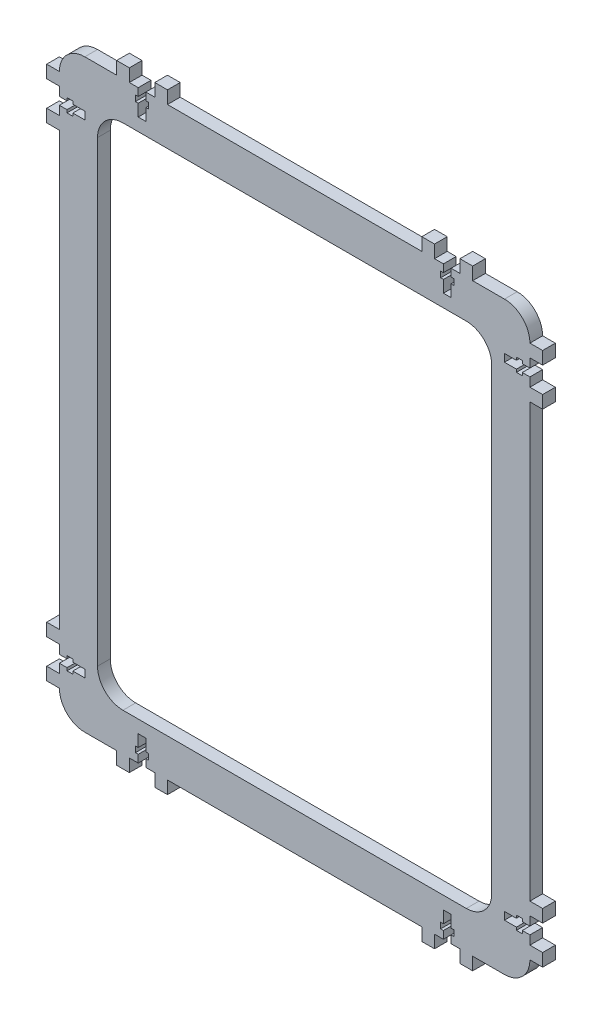
from build123d import *

# Parameters (mm, degrees)
SKETCH1_W           = 155
SKETCH1_H           = 200
BOSS_EXTRUDE1_DEPTH = 5
FILLET1_DEPTH       = 5
FILLET1_2_DEPTH     = 5


with BuildPart() as part:
    # Sketch1 → Boss-Extrude1 (new body)
    with BuildSketch(Plane.XY):
        Polygon((-92.5, 96.5), (-92.5, 100), (-97.5, 100), (-97.5, 105), (-92.5, 105), (-92.5, 115), (-70, 115), (-70, 120), (-65, 120), (-65, 115), (-61.5, 115), (-61.5, 112), (-62.6, 112), (-62.6, 109.7), (-61.5, 109.7), (-61.5, 105), (-58.5, 105), (-58.5, 109.7), (-57.4, 109.7), (-57.4, 112), (-58.5, 112), (-58.5, 115), (-55, 115), (-55, 120), (-50, 120), (-50, 115), (50, 115), (50, 120), (55, 120), (55, 115), (58.5, 115), (58.5, 112), (57.4, 112), (57.4, 109.7), (58.5, 109.7), (58.5, 105), (61.5, 105), (61.5, 109.7), (62.6, 109.7), (62.6, 112), (61.5, 112), (61.5, 115), (65, 115), (65, 120), (70, 120), (70, 115), (92.5, 115), (92.5, 105), (97.5, 105), (97.5, 100), (92.5, 100), (92.5, 96.5), (89.5, 96.5), (89.5, 97.6), (87.2, 97.6), (87.2, 96.5), (82.5, 96.5), (82.5, 93.5), (87.2, 93.5), (87.2, 92.4), (89.5, 92.4), (89.5, 93.5), (92.5, 93.5), (92.5, 90), (97.5, 90), (97.5, 85), (92.5, 85), (92.5, -85), (97.5, -85), (97.5, -90), (92.5, -90), (92.5, -93.5), (89.5, -93.5), (89.5, -92.4), (87.2, -92.4), (87.2, -93.5), (82.5, -93.5), (82.5, -96.5), (87.2, -96.5), (87.2, -97.6), (89.5, -97.6), (89.5, -96.5), (92.5, -96.5), (92.5, -100), (97.5, -100), (97.5, -105), (92.5, -105), (92.5, -115), (70, -115), (70, -120), (65, -120), (65, -115), (61.5, -115), (61.5, -112), (62.6, -112), (62.6, -109.7), (61.5, -109.7), (61.5, -105), (58.5, -105), (58.5, -109.7), (57.4, -109.7), (57.4, -112), (58.5, -112), (58.5, -115), (55, -115), (55, -120), (50, -120), (50, -115), (-50, -115), (-50, -120), (-55, -120), (-55, -115), (-58.5, -115), (-58.5, -112), (-57.4, -112), (-57.4, -109.7), (-58.5, -109.7), (-58.5, -105), (-61.5, -105), (-61.5, -109.7), (-62.6, -109.7), (-62.6, -112), (-61.5, -112), (-61.5, -115), (-65, -115), (-65, -120), (-70, -120), (-70, -115), (-92.5, -115), (-92.5, -105), (-97.5, -105), (-97.5, -100), (-92.5, -100), (-92.5, -96.5), (-89.5, -96.5), (-89.5, -97.6), (-87.2, -97.6), (-87.2, -96.5), (-82.5, -96.5), (-82.5, -93.5), (-87.2, -93.5), (-87.2, -92.4), (-89.5, -92.4), (-89.5, -93.5), (-92.5, -93.5), (-92.5, -90), (-97.5, -90), (-97.5, -85), (-92.5, -85), (-92.5, 85), (-97.5, 85), (-97.5, 90), (-92.5, 90), (-92.5, 93.5), (-89.5, 93.5), (-89.5, 92.4), (-87.2, 92.4), (-87.2, 93.5), (-82.5, 93.5), (-82.5, 96.5), (-87.2, 96.5), (-87.2, 97.6), (-89.5, 97.6), (-89.5, 96.5), align=None)
        Rectangle(SKETCH1_W, SKETCH1_H, mode=Mode.SUBTRACT)
    extrude(amount=BOSS_EXTRUDE1_DEPTH)

    # Fillet1: read off the stored shape, not the designer's step
    # Fillet1 outline → Fillet1 (cut)
    with BuildSketch(Plane.XY):
        with BuildLine():
            Line((92.5, -115), (92.5, -105))
            ThreePointArc((92.5, -105), (89.571067812, -112.071067812), (82.5, -115))
            Line((82.5, -115), (92.5, -115))
        make_face()
        with BuildLine():
            Line((-92.5, -115), (-82.5, -115))
            ThreePointArc((-82.5, -115), (-89.571067812, -112.071067812), (-92.5, -105))
            Line((-92.5, -105), (-92.5, -115))
        make_face()
        with BuildLine():
            Line((-92.5, 115), (-92.5, 105))
            ThreePointArc((-92.5, 105), (-89.571067812, 112.071067812), (-82.5, 115))
            Line((-82.5, 115), (-92.5, 115))
        make_face()
        with BuildLine():
            Line((92.5, 115), (82.5, 115))
            ThreePointArc((82.5, 115), (89.571067812, 112.071067812), (92.5, 105))
            Line((92.5, 105), (92.5, 115))
        make_face()
    extrude(amount=FILLET1_DEPTH, mode=Mode.SUBTRACT)

    # Fillet1 2 outline → Fillet1 2 (add)
    with BuildSketch(Plane.XY):
        with BuildLine():
            ThreePointArc((-67.5, -100), (-74.571067812, -97.071067812), (-77.5, -90))
            Line((-77.5, -90), (-77.5, -100))
            Line((-77.5, -100), (-67.5, -100))
        make_face()
        with BuildLine():
            Line((-77.5, 100), (-77.5, 90))
            ThreePointArc((-77.5, 90), (-74.571067812, 97.071067812), (-67.5, 100))
            Line((-67.5, 100), (-77.5, 100))
        make_face()
        with BuildLine():
            ThreePointArc((77.5, -90), (74.571067812, -97.071067812), (67.5, -100))
            Line((67.5, -100), (77.5, -100))
            Line((77.5, -100), (77.5, -90))
        make_face()
        with BuildLine():
            Line((77.5, 100), (67.5, 100))
            ThreePointArc((67.5, 100), (74.571067812, 97.071067812), (77.5, 90))
            Line((77.5, 90), (77.5, 100))
        make_face()
    extrude(amount=FILLET1_2_DEPTH)


solid = part.part
